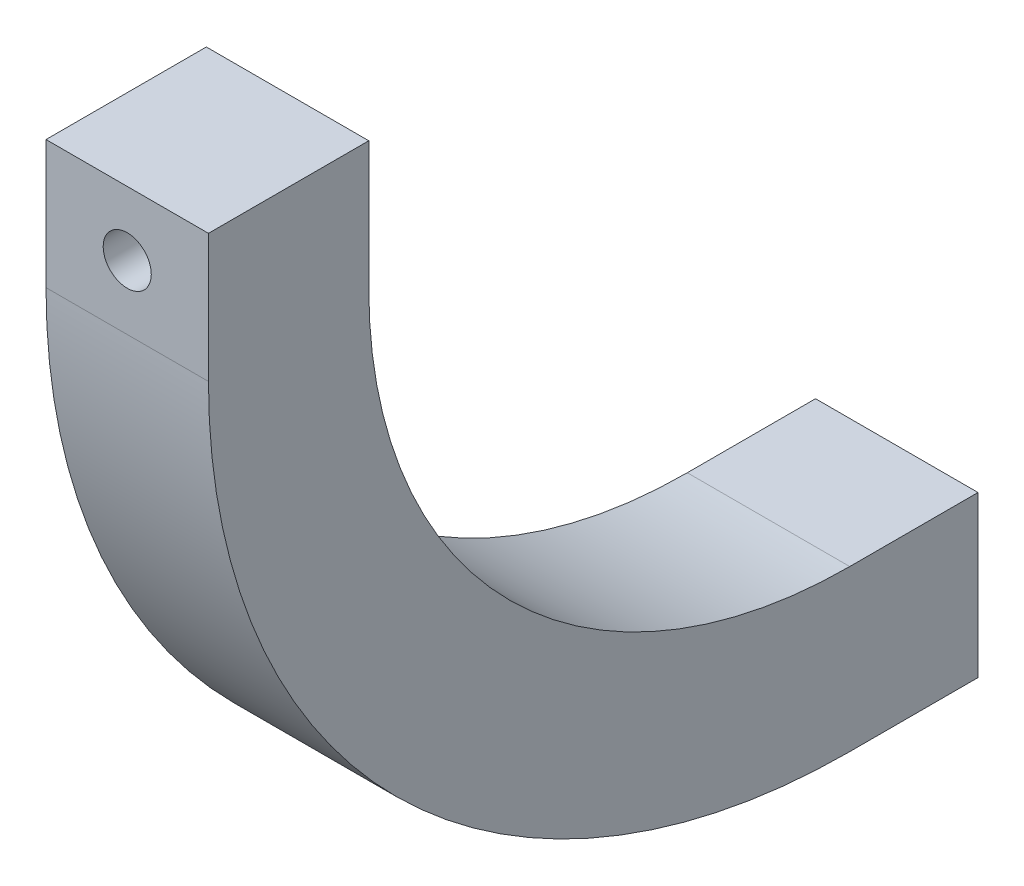
from build123d import *

# Parameters (mm, degrees)
BOSS_EXTRUDE1_DEPTH      = 7.6
BOSS_EXTRUDE1_DEPTH_BACK = 7.6
SKETCH7_R                = 2.25
CUT_EXTRUDE1_DEPTH       = 94.646996748
SKETCH15_R               = 1.5
CUT_EXTRUDE11_DEPTH      = 6


with BuildPart() as part:
    # Sketch5 → Boss-Extrude1 (new, two sides: drawn at the far end of the back side and taken through both)
    with BuildSketch(Plane(origin=(0, 0, 0), x_dir=(0, 0, -1), z_dir=(1, 0, 0)).offset(-BOSS_EXTRUDE1_DEPTH_BACK)):
        with BuildLine():
            Line((-51, 6), (-51, 0))
            Line((-51, 0), (-51, -6))
            ThreePointArc((-51, -6), (-37.819805153, -37.819805153), (-6, -51))
            Line((-6, -51), (0, -51))
            Line((0, -51), (6, -51))
            Line((6, -51), (6, -66))
            Line((6, -66), (-6, -66))
            ThreePointArc((-6, -66), (-48.426406871, -48.426406871), (-66, -6))
            Line((-66, -6), (-66, 6))
            Line((-66, 6), (-51, 6))
        make_face()
    extrude(amount=BOSS_EXTRUDE1_DEPTH + BOSS_EXTRUDE1_DEPTH_BACK)

    # Sketch7 → Cut-Extrude1 (cut, through all)
    with BuildSketch(Plane.XY):
        Circle(SKETCH7_R)
    extrude(amount=CUT_EXTRUDE1_DEPTH, mode=Mode.SUBTRACT)

    # Sketch15 → Cut-Extrude11 (cut)
    with BuildSketch(Plane.XZ.offset(66)):
        Circle(SKETCH15_R)
    extrude(amount=-CUT_EXTRUDE11_DEPTH, mode=Mode.SUBTRACT)


solid = part.part
